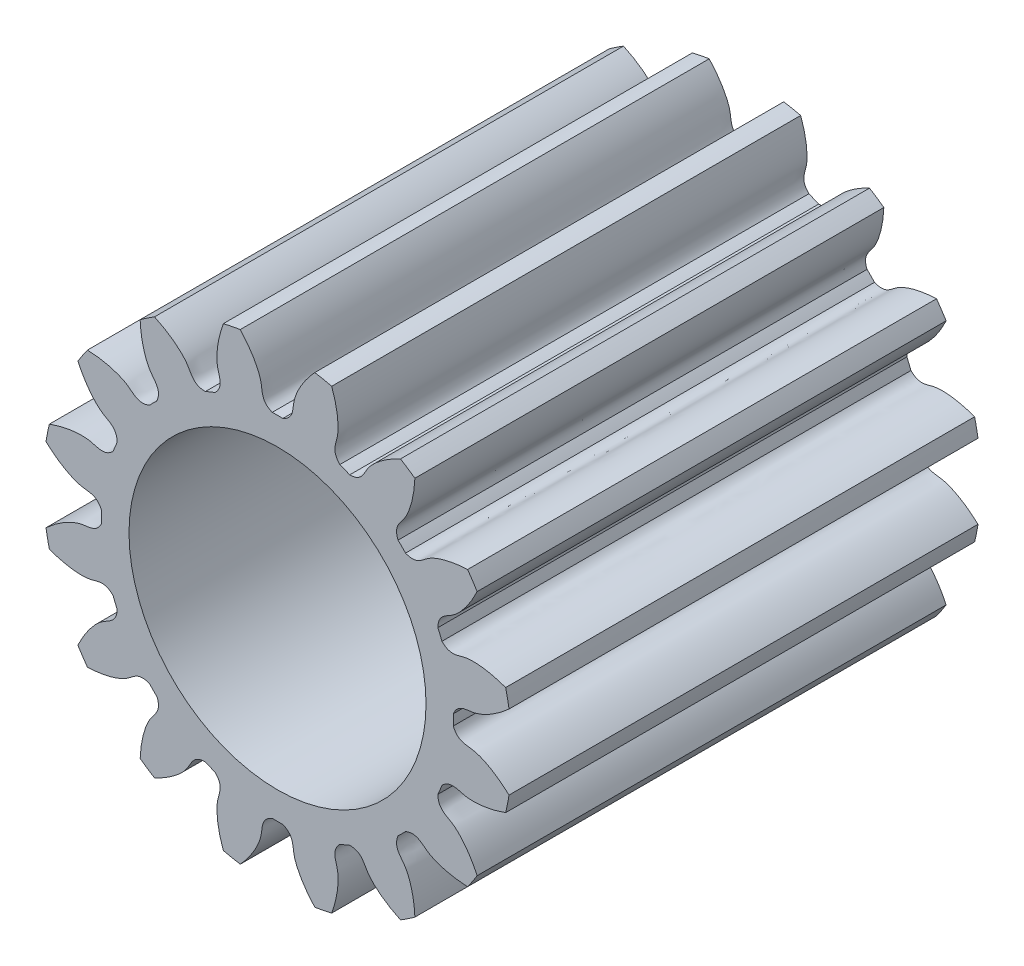
from build123d import *

# Parameters (mm, degrees)
SKETCH_1_R               = 4.5
EXTRUDE_1_DEPTH          = 9
CUT_EXTRUDE_1_DEPTH      = 12.022703843
PATTERN_CIRCULAR_1_COUNT = 16
SKETCH_4_R               = 2.85
CUT_EXTRUDE_2_DEPTH      = 10


with BuildPart() as part:
    # 草图1 → 凸台-拉伸1 (new body)
    with BuildSketch(Plane.XY):
        Circle(SKETCH_1_R)
    extrude(amount=EXTRUDE_1_DEPTH)

    # 草图2 → 切除-拉伸1 (cut, through all)
    with BuildSketch(Plane.XY):
        with BuildLine():
            ThreePointArc((0.101680395, 3.373467963), (0, 3.375), (-0.101680395, 3.373467963))
            add(Edge.make_bspline(
                [(-0.101680395, 3.373467963), (-0.320919735, 3.465061005), (-0.284660598, 3.635349809), (-0.322390644, 3.793404963), (-0.325601394, 3.80577545), (-0.329466049, 3.819526781), (-0.334039479, 3.834637453), (-0.339377888, 3.851083952), (-0.345536205, 3.868841182), (-0.352568839, 3.887882349), (-0.360529384, 3.908179024), (-0.369470654, 3.92970115), (-0.379444617, 3.952417062), (-0.390502356, 3.976293514), (-0.402694025, 4.001295699), (-0.416068812, 4.02738727), (-0.430674889, 4.054530373), (-0.446559381, 4.082685666), (-0.463768319, 4.111812348), (-0.482346604, 4.141868189), (-0.502337967, 4.172809557), (-0.523784931, 4.20459145), (-0.546728776, 4.237167525), (-0.571209498, 4.270490132), (-0.597265778, 4.304510345), (-0.624934946, 4.339177997), (-0.654252942, 4.374441713), (-0.685254293, 4.41024895), (-0.717972069, 4.446546028), (-0.752437861, 4.483278171), (-0.788681746, 4.520389541), (-0.826732258, 4.557823283), (-0.866616358, 4.595521557), (-0.90835941, 4.633425586), (-0.951985152, 4.67147569), (-0.99751567, 4.709611333), (-1.044971373, 4.747771162), (-1.094370973, 4.785893051), (-1.145731456, 4.823914147), (-1.199068069, 4.861770908), (-1.254394289, 4.899399156), (-1.311721817, 4.936734114), (-1.371060539, 4.97371046), (-1.453732402, 5.022959339), (-1.517494148, 5.058370721), (-1.560889991, 5.081371225)],
                knots=[0, 0, 0, 0, 0.200958108, 0.205848205, 0.211390316, 0.217584439, 0.224430575, 0.231928724, 0.240078886, 0.248881062, 0.25833525, 0.268441451, 0.279199665, 0.290609892, 0.302672132, 0.315386384, 0.32875265, 0.342770929, 0.357441221, 0.372763526, 0.388737843, 0.405364174, 0.422642518, 0.440572874, 0.459155244, 0.478389626, 0.498276022, 0.51881443, 0.540004852, 0.561847286, 0.584341734, 0.607488194, 0.631286667, 0.655737153, 0.680839653, 0.706594165, 0.73300069, 0.760059228, 0.787769779, 0.816132343, 0.84514692, 0.87481351, 0.905132113, 0.936102729, 1, 1, 1, 1], degree=3))
            ThreePointArc((-1.560889991, 5.081371225), (0, 5.315704195), (1.560889991, 5.081371225))
            add(Edge.make_bspline(
                [(0.101680395, 3.373467963), (0.320919735, 3.465061005), (0.284660598, 3.635349809), (0.322390644, 3.793404963), (0.325601394, 3.80577545), (0.329466049, 3.819526781), (0.334039479, 3.834637453), (0.339377888, 3.851083952), (0.345536205, 3.868841182), (0.352568839, 3.887882349), (0.360529384, 3.908179024), (0.369470654, 3.92970115), (0.379444617, 3.952417062), (0.390502356, 3.976293514), (0.402694025, 4.001295699), (0.416068812, 4.02738727), (0.430674889, 4.054530373), (0.446559381, 4.082685666), (0.463768319, 4.111812348), (0.482346604, 4.141868189), (0.502337967, 4.172809557), (0.523784931, 4.20459145), (0.546728776, 4.237167525), (0.571209498, 4.270490132), (0.597265778, 4.304510345), (0.624934946, 4.339177997), (0.654252942, 4.374441713), (0.685254293, 4.41024895), (0.717972069, 4.446546028), (0.752437861, 4.483278171), (0.788681746, 4.520389541), (0.826732258, 4.557823283), (0.866616358, 4.595521557), (0.90835941, 4.633425586), (0.951985152, 4.67147569), (0.99751567, 4.709611333), (1.044971373, 4.747771162), (1.094370973, 4.785893051), (1.145731456, 4.823914147), (1.199068069, 4.861770908), (1.254394289, 4.899399156), (1.311721817, 4.936734114), (1.371060539, 4.97371046), (1.453732402, 5.022959339), (1.517494148, 5.058370721), (1.560889991, 5.081371225)],
                knots=[0, 0, 0, 0, 0.200958108, 0.205848205, 0.211390316, 0.217584439, 0.224430575, 0.231928724, 0.240078886, 0.248881062, 0.25833525, 0.268441451, 0.279199665, 0.290609892, 0.302672132, 0.315386384, 0.32875265, 0.342770929, 0.357441221, 0.372763526, 0.388737843, 0.405364174, 0.422642518, 0.440572874, 0.459155244, 0.478389626, 0.498276022, 0.51881443, 0.540004852, 0.561847286, 0.584341734, 0.607488194, 0.631286667, 0.655737153, 0.680839653, 0.706594165, 0.73300069, 0.760059228, 0.787769779, 0.816132343, 0.84514692, 0.87481351, 0.905132113, 0.936102729, 1, 1, 1, 1], degree=3))
        make_face()
    cut_extrude_1 = extrude(amount=CUT_EXTRUDE_1_DEPTH, mode=Mode.SUBTRACT)

    # 阵列(圆周)1: 切除-拉伸1 ×16 about axis
    pattern_circular_1_axis = Axis((0, 0, 9), (0, 0, -1))
    for i in range(1, PATTERN_CIRCULAR_1_COUNT):
        add(cut_extrude_1.rotate(pattern_circular_1_axis, i * 360 / PATTERN_CIRCULAR_1_COUNT), mode=Mode.SUBTRACT)

    # 草图4 → 切除-拉伸2 (cut)
    with BuildSketch(Plane.XY.offset(9)):
        Circle(SKETCH_4_R)
    extrude(amount=-CUT_EXTRUDE_2_DEPTH, mode=Mode.SUBTRACT)


solid = part.part
